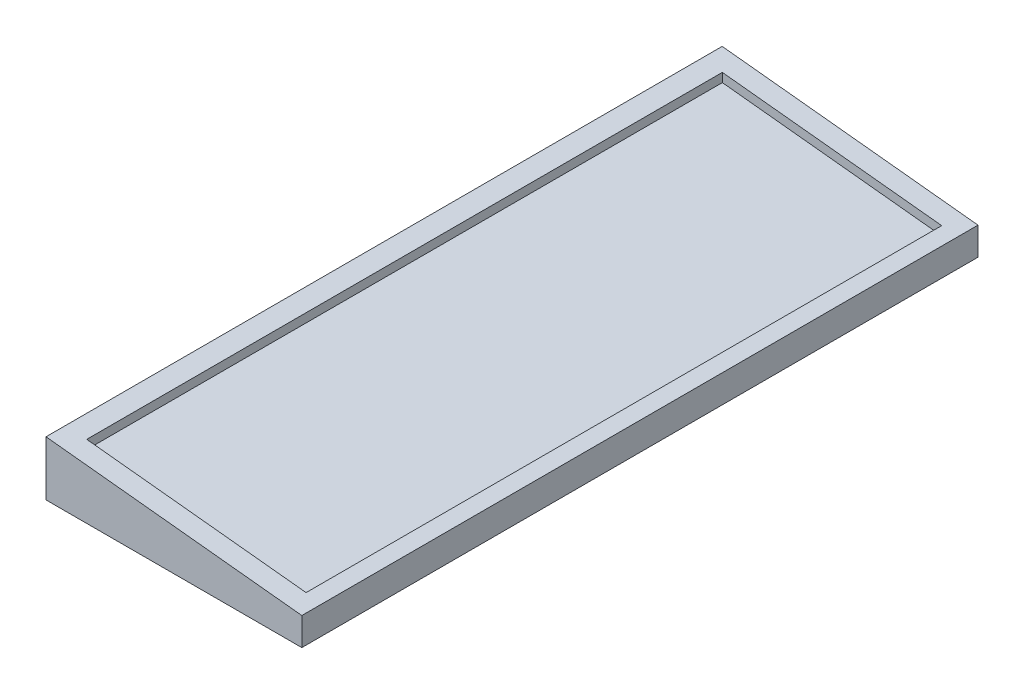
from build123d import *

# Parameters (mm, degrees)
TOP_CASE_MAIN_DEPTH         = 383.27
TOP_CASE_CUT_REACH          = 393.297
SKETCH17_W                  = 139
SKETCH17_H                  = 377.27
TOP_PLATE_AND_RETENTION_W   = 124.32619313
TOP_PLATE_AND_RETENTION_H   = 360.27
TOP_CASE_CUT_EXTRUDE3_DEPTH = 392.278198101
PCB_SKETCH_W                = 123
PCB_SKETCH_H                = 358.27
PCB_MAIN_DEPTH              = 1.58
TOP_START                   = -379.27
TOP_PLATE_DEPTH             = 375.27
BASE_CASE_MAIN_REACH        = 393.297
SKETCH21_W                  = 138.6
SKETCH21_H                  = 376.87
CUT_EXTRUDE2_START          = -3.5
SKETCH24_W                  = 123
SKETCH24_H                  = 361.27
CUT_EXTRUDE2_DEPTH          = 388.796745323


# Read off the part's stored shape, not the designer's step: top plate
with BuildPart() as part:
    # side profile → top case main (new body)
    with BuildSketch(Plane.XY):
        Polygon((-72.5, 0), (72.5, 0), (72.5, 15.759885886), (-72.5, 31), align=None)
    extrude(amount=-TOP_CASE_MAIN_DEPTH)

    # top case cut: up to this plane
    top_case_cut_end = Plane(origin=(71.977357684, 10.78727641, -383.27), z_dir=(0.10452846326764624, 0.9945218953682741, 0))
    # Sketch17 → top case cut (cut, up to the surface)
    with BuildSketch(Plane.XZ, mode=Mode.PRIVATE) as top_case_cut_sk1:
        with Locations((0, -191.635)):
            Rectangle(SKETCH17_W, SKETCH17_H)
    top_case_cut_tool1 = split(extrude(top_case_cut_sk1.sketch, amount=-TOP_CASE_CUT_REACH, mode=Mode.PRIVATE), bisect_by=top_case_cut_end, keep=Keep.BOTH, mode=Mode.PRIVATE)
    add(top_case_cut_tool1.solids().sort_by_distance((0, 0, -191.635))[0], mode=Mode.SUBTRACT)

    # top plate and retention → top case Cut-Extrude3 (cut, through all)
    with BuildSketch(Plane(origin=(0.919925149, 2.5, 0), x_dir=(1, 0, 0), z_dir=(0, 1, 0))):
        with Locations((0.332325841, 191.635)):
            Rectangle(TOP_PLATE_AND_RETENTION_W, TOP_PLATE_AND_RETENTION_H)
    extrude(amount=TOP_CASE_CUT_EXTRUDE3_DEPTH, mode=Mode.SUBTRACT)


with BuildPart() as body_2:
    # pcb sketch → pcb main (new body)
    with BuildSketch(Plane(origin=(1.343385716, 12.781461307, 0), x_dir=(0.9945218953682741, -0.10452846326764635, 0), z_dir=(-0.10452846326764635, -0.9945218953682741, 0))):
        with Locations((-1.184720769, -191.635)):
            Rectangle(PCB_SKETCH_W, PCB_SKETCH_H)
    extrude(amount=PCB_MAIN_DEPTH)


with BuildPart() as body_3:
    # top plate outline → top plate (new body)
    with BuildSketch(Plane.XY.offset(TOP_START)):
        Polygon((68.5, 9.15000729), (68.5, 10.65000729), (-68.5, 25.049287521), (-68.5, 23.549287521), align=None)
    extrude(amount=TOP_PLATE_DEPTH)


with BuildPart() as body_4:
    # base case main: up to this plane
    base_case_main_end = Plane(origin=(1.803310955, 15.657357647, 0), z_dir=(0.10452846326764625, 0.9945218953682742, 0))
    # Sketch21 → base case main (new, up to the surface)
    with BuildSketch(Plane.XZ, mode=Mode.PRIVATE) as base_case_main_sk1:
        with Locations((0, -191.635)):
            Rectangle(SKETCH21_W, SKETCH21_H)
    base_case_main_tool1 = split(extrude(base_case_main_sk1.sketch, amount=-BASE_CASE_MAIN_REACH, mode=Mode.PRIVATE), bisect_by=base_case_main_end, keep=Keep.BOTH, mode=Mode.PRIVATE)
    add(base_case_main_tool1.solids().sort_by_distance((0, 0, -191.635))[0])

    # Sketch24 → Cut-Extrude2 (cut, through all)
    with BuildSketch(Plane.XZ.offset(CUT_EXTRUDE2_START)):
        with Locations((0, -191.635)):
            Rectangle(SKETCH24_W, SKETCH24_H)
    extrude(amount=-CUT_EXTRUDE2_DEPTH, mode=Mode.SUBTRACT)


solid = Compound([part.part, body_2.part, body_3.part, body_4.part])
